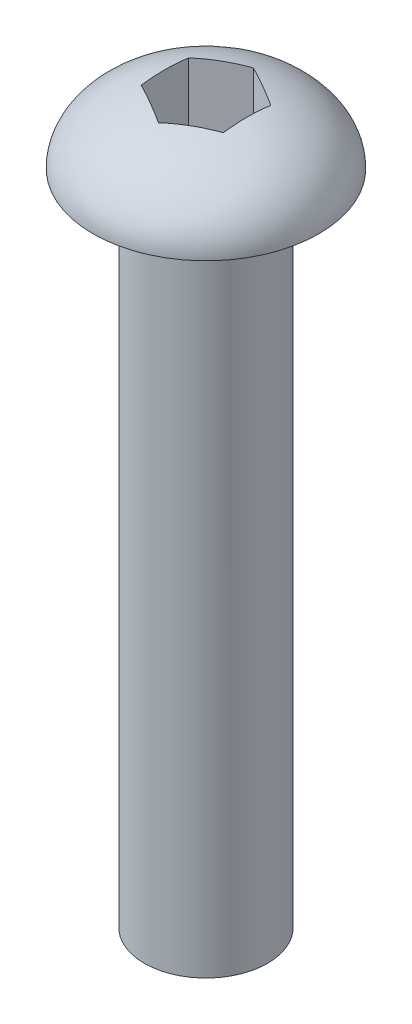
from build123d import *
from build123d.topology import SkipClean

# Parameters (mm, degrees)
SKETCH1_R           = 1.5
BOSS_EXTRUDE1_DEPTH = 16
SKETCH2_R           = 2.75
BOSS_EXTRUDE2_DEPTH = 0.1
SKETCH3_R           = 2.75
SKETCH3_R_2         = 1.5
CUT_EXTRUDE1_DEPTH  = 0.1
CUT_EXTRUDE2_DEPTH  = 2


# Read off the part's stored shape, not the designer's step: Dome1
with BuildPart() as part:
    # Sketch1 → Boss-Extrude1 (new body)
    with BuildSketch(Plane(origin=(0, 0, 0), x_dir=(1, 0, 0), z_dir=(0, 1, 0))):
        with Locations(Location((0, 0, 0), (0, 0, 270))):
            Circle(SKETCH1_R)
    extrude(amount=BOSS_EXTRUDE1_DEPTH)

    # Sketch2 → Boss-Extrude2 (add)
    with BuildSketch(Plane(origin=(0, 16, 0), x_dir=(1, 0, 0), z_dir=(0, 1, 0))):
        with Locations(Location((0, 0, 0), (0, 0, 270))):
            Circle(SKETCH2_R)
    extrude(amount=-BOSS_EXTRUDE2_DEPTH)

    # Dome1 outline → Dome1 (revolve)
    with BuildSketch(Plane.XY):
        with BuildLine():
            add(Edge.make_bspline(
                [(0, 17.7), (2.75, 17.7), (2.75, 16)],
                knots=[4.71238898, 4.71238898, 4.71238898, 6.283185307, 6.283185307, 6.283185307], degree=2, weights=[1, 0.707106781, 1]))
            Line((0, 17.7), (0, 16))
            Line((0, 16), (2.75, 16))
        make_face()
    revolve(axis=Axis((0, 0, 0), (0, 1, 0)))

    # Sketch3 → Cut-Extrude1 (cut)
    with SkipClean():  # the faces are left unmerged after this step: merging them gives an invalid solid
        with BuildSketch(Plane.XZ.offset(-15.9)):
            Circle(SKETCH3_R)
            with Locations(Location((0, 0, 0), (0, 0, 270))):
                Circle(SKETCH3_R_2, mode=Mode.SUBTRACT)
        extrude(amount=-CUT_EXTRUDE1_DEPTH, mode=Mode.SUBTRACT)

    # Sketch4 → Cut-Extrude2 (cut)
    with SkipClean():  # the faces are left unmerged after this step: merging them gives an invalid solid
        with BuildSketch(Plane(origin=(0, 17.7, 0), x_dir=(-1, 0, 0), z_dir=(0, -1, 0))):
            Polygon((0, 1.154700538), (-1, 0.577350269), (-1, -0.577350269), (0, -1.154700538), (1, -0.577350269), (1, 0.577350269), align=None)
        extrude(amount=CUT_EXTRUDE2_DEPTH, mode=Mode.SUBTRACT)


solid = part.part
